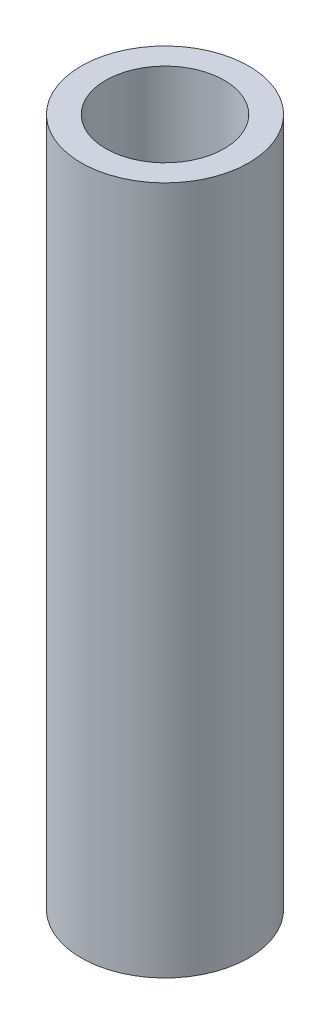
from build123d import *

# Parameters (mm, degrees)
SKETCH1_R           = 8.525
SKETCH1_R_2         = 6.025
EXTRUDE_THIN1_DEPTH = 70


with BuildPart() as part:
    # Sketch1 → Extrude-Thin1 (new body)
    with BuildSketch(Plane(origin=(0, 0, 0), x_dir=(1, 0, 0), z_dir=(0, 1, 0))):
        Circle(SKETCH1_R)
        Circle(SKETCH1_R_2, mode=Mode.SUBTRACT)
    extrude(amount=EXTRUDE_THIN1_DEPTH)


solid = part.part
